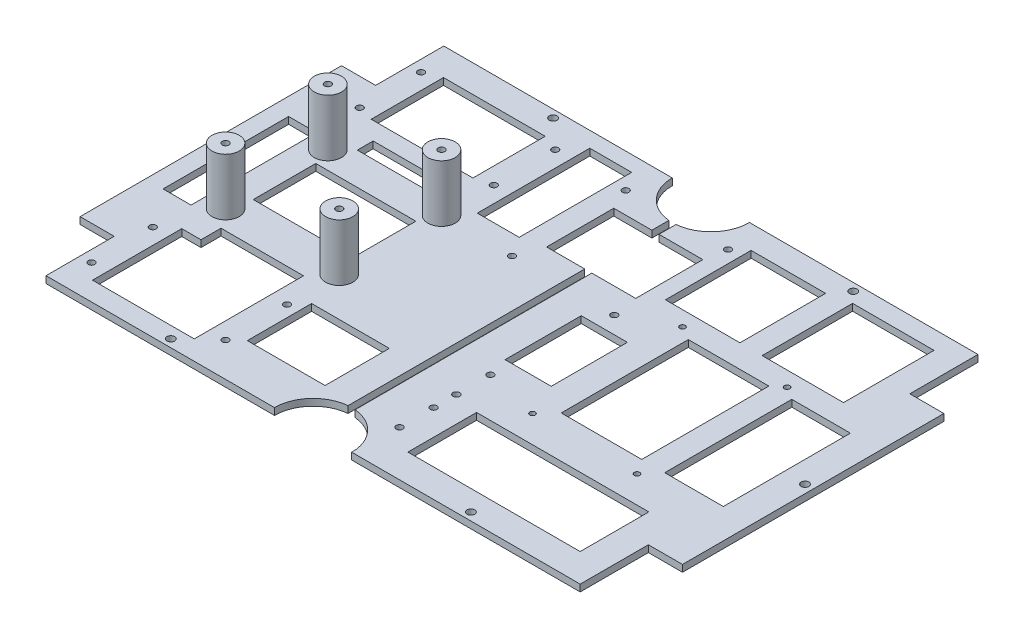
from build123d import *

# Parameters (mm, degrees)
SKETCH1_W           = 265
SKETCH1_H           = 175
BOSS_EXTRUDE3_DEPTH = 3
SKETCH2_R           = 1.2
SKETCH2_R_2         = 1.45
CUT_EXTRUDE1_DEPTH  = 10
SKETCH3_R           = 1.7
CUT_EXTRUDE2_DEPTH  = 10
SKETCH4_R           = 17
SKETCH4_W           = 15
SKETCH4_H           = 30
CUT_EXTRUDE3_DEPTH  = 10
SKETCH5_R           = 6
BOSS_EXTRUDE4_DEPTH = 25
SKETCH6_R           = 1.45
CUT_EXTRUDE4_DEPTH  = 16
SKETCH7_W           = 3.133632398
SKETCH7_H           = 141.144714622
CUT_EXTRUDE5_DEPTH  = 16
SKETCH8_W           = 44.004051782
SKETCH8_H           = 27.502532364
SKETCH8_W_2         = 12.303764479
SKETCH8_H_2         = 55.212044537
SKETCH8_W_3         = 44.752484312
SKETCH8_H_3         = 31.794399539
SKETCH8_W_4         = 18.417789402
SKETCH8_H_4         = 49.48036565
SKETCH8_W_5         = 35.622307927
SKETCH8_H_5         = 6.958328597
SKETCH8_W_6         = 34.203626282
SKETCH8_H_6         = 28.27990646
SKETCH8_W_7         = 39.195026094
SKETCH8_H_7         = 29.538035132
SKETCH8_W_8         = 32.745400695
SKETCH8_H_8         = 37.666328028
SKETCH8_W_9         = 35.809297836
SKETCH8_H_9         = 39.795761931
SKETCH8_W_10        = 35.421118703
SKETCH8_H_10        = 55.905577856
SKETCH8_W_11        = 20.303215676
SKETCH8_H_11        = 33.500994529
SKETCH8_W_12        = 75.78944242
SKETCH8_H_12        = 30.210998937
SKETCH8_W_13        = 25.777903598
CUT_EXTRUDE6_DEPTH  = 10


with BuildPart() as part:
    # Sketch1 → Boss-Extrude3 (new body)
    with BuildSketch(Plane(origin=(0, 0, 0), x_dir=(1, 0, 0), z_dir=(0, 1, 0))):
        Rectangle(SKETCH1_W, SKETCH1_H)
    extrude(amount=BOSS_EXTRUDE3_DEPTH)

    # Sketch2 → Cut-Extrude1 (cut)
    with BuildSketch(Plane(origin=(0, 3, 0), x_dir=(1, 0, 0), z_dir=(0, 1, 0))):
        with Locations((88, 33)):
            Circle(SKETCH2_R)
        with Locations((42, 33)):
            Circle(SKETCH2_R)
        with Locations((88, -33)):
            Circle(SKETCH2_R)
        with Locations((42, -33)):
            Circle(SKETCH2_R)
        with Locations((18, -67.5)):
            Circle(SKETCH2_R_2)
        with Locations((18, -52.5)):
            Circle(SKETCH2_R_2)
        with Locations((18, -42.5)):
            Circle(SKETCH2_R_2)
        with Locations((18, -27.5)):
            Circle(SKETCH2_R_2)
        with Locations((-53.5, -72.5)):
            Circle(SKETCH2_R_2)
        with Locations((-53.5, -45.5)):
            Circle(SKETCH2_R_2)
        with Locations((-112.5, -45.5)):
            Circle(SKETCH2_R_2)
        with Locations((-112.5, -72.5)):
            Circle(SKETCH2_R_2)
        with Locations((-112.5, 45.5)):
            Circle(SKETCH2_R_2)
        with Locations((-53.5, 45.5)):
            Circle(SKETCH2_R_2)
        with Locations((-53.5, 72.5)):
            Circle(SKETCH2_R_2)
        with Locations((-112.5, 72.5)):
            Circle(SKETCH2_R_2)
        with Locations((-22.5, 22.5)):
            Circle(SKETCH2_R_2)
        with Locations((22.5, 22.5)):
            Circle(SKETCH2_R_2)
        with Locations((-22.5, 72.5)):
            Circle(SKETCH2_R_2)
        with Locations((22.5, 72.5)):
            Circle(SKETCH2_R_2)
    extrude(amount=-CUT_EXTRUDE1_DEPTH, mode=Mode.SUBTRACT)

    # Sketch3 → Cut-Extrude2 (cut)
    with BuildSketch(Plane(origin=(0, 3, 0), x_dir=(1, 0, 0), z_dir=(0, 1, 0))):
        with Locations((-66, 84.1)):
            Circle(SKETCH3_R)
        with Locations((-128.9, 0)):
            Circle(SKETCH3_R)
        with Locations((-66, -84.1)):
            Circle(SKETCH3_R)
        with Locations((66, -84.1)):
            Circle(SKETCH3_R)
        with Locations((66, 84.1)):
            Circle(SKETCH3_R)
        with Locations((128.9, 0)):
            Circle(SKETCH3_R)
    extrude(amount=-CUT_EXTRUDE2_DEPTH, mode=Mode.SUBTRACT)

    # Sketch4 → Cut-Extrude3 (cut)
    with BuildSketch(Plane(origin=(0, 3, 0), x_dir=(1, 0, 0), z_dir=(0, 1, 0))):
        with Locations((0, 87.5)):
            Circle(SKETCH4_R)
        with Locations((0, -87.5)):
            Circle(SKETCH4_R)
        with Locations((-125, 72.5)):
            Rectangle(SKETCH4_W, SKETCH4_H)
        with Locations((-125, -72.5)):
            Rectangle(SKETCH4_W, SKETCH4_H)
        with Locations((125, -72.5)):
            Rectangle(SKETCH4_W, SKETCH4_H)
        with Locations((125, 72.5)):
            Rectangle(SKETCH4_W, SKETCH4_H)
    extrude(amount=-CUT_EXTRUDE3_DEPTH, mode=Mode.SUBTRACT)

    # Sketch5 → Boss-Extrude4 (add)
    with BuildSketch(Plane(origin=(0, 3, 0), x_dir=(1, 0, 0), z_dir=(0, 1, 0))):
        with Locations((-53.5, 22.5)):
            Circle(SKETCH5_R)
        with Locations((-53.5, -22.5)):
            Circle(SKETCH5_R)
        with Locations((-103.5, -22.5)):
            Circle(SKETCH5_R)
        with Locations((-103.5, 22.5)):
            Circle(SKETCH5_R)
    extrude(amount=BOSS_EXTRUDE4_DEPTH)

    # Sketch6 → Cut-Extrude4 (cut)
    with BuildSketch(Plane(origin=(0, 28, 0), x_dir=(1, 0, 0), z_dir=(0, 1, 0))):
        with Locations((-103.5, 22.5)):
            Circle(SKETCH6_R)
        with Locations((-53.5, 22.5)):
            Circle(SKETCH6_R)
        with Locations((-53.5, -22.5)):
            Circle(SKETCH6_R)
        with Locations((-103.5, -22.5)):
            Circle(SKETCH6_R)
    extrude(amount=-CUT_EXTRUDE4_DEPTH, mode=Mode.SUBTRACT)

    # Sketch7 → Cut-Extrude5 (cut)
    with BuildSketch(Plane(origin=(0, 3, 0), x_dir=(1, 0, 0), z_dir=(0, 1, 0))):
        Rectangle(SKETCH7_W, SKETCH7_H)
    extrude(amount=-CUT_EXTRUDE5_DEPTH, mode=Mode.SUBTRACT)


with BuildPart() as cut_extrude5_piece_1:
    # of the separate pieces the step leaves, piece 1, a body of its own (cut_extrude5_pieces)
    add(part.part.solids().sort_by_distance((-117.5, 0, -87.5))[0])


with BuildPart() as cut_extrude5_piece_2:
    # of the separate pieces the step leaves, piece 2, a body of its own (cut_extrude5_pieces)
    add(part.part.solids().sort_by_distance((1.566816199, 0, -70.572357311))[0])


with BuildPart() as cut_extrude6_tool:
    # Sketch8 → Cut-Extrude6 (new body)
    with BuildSketch(Plane(origin=(0, 3, 0), x_dir=(1, 0, 0), z_dir=(0, 1, 0))):
        with Locations((-78.918320173, 0.855666755)):
            Rectangle(SKETCH8_W, SKETCH8_H)
        with Locations((-118.65224193, -1.087828844)):
            Rectangle(SKETCH8_W_2, SKETCH8_H_2)
        with Locations((-83.191731608, 59.522375806)):
            Rectangle(SKETCH8_W_3, SKETCH8_H_3)
        with Locations((-37.255467463, 55.937928823)):
            Rectangle(SKETCH8_W_4, SKETCH8_H_4)
        with Locations((-79.05742687, 32.298336537)):
            Rectangle(SKETCH8_W_5, SKETCH8_H_5)
        Polygon((-105.567973764, -39.71130787), (-105.567973764, -78.974026671), (-60.815489452, -78.974026671), (-60.815489452, -30.899446131), (-97.101226796, -30.899446131), (-97.101226796, -39.71130787), align=None)
        with Locations((-31.38483974, -53.81421566)):
            Rectangle(SKETCH8_W_6, SKETCH8_H_6)
        with Locations((1.26798102, 48.327638245)):
            Rectangle(SKETCH8_W_7, SKETCH8_H_7)
        with Locations((44.324575156, 58.40829682)):
            Rectangle(SKETCH8_W_8, SKETCH8_H_8)
        with Locations((88.368096558, 59.473013771)):
            Rectangle(SKETCH8_W_9, SKETCH8_H_9)
        with Locations((65.827945176, 1.492751977)):
            Rectangle(SKETCH8_W_10, SKETCH8_H_10)
        with Locations((25.617903277, -1.759507226)):
            Rectangle(SKETCH8_W_11, SKETCH8_H_11)
        with Locations((67.190705071, -59.996509461)):
            Rectangle(SKETCH8_W_12, SKETCH8_H_12)
        with Locations((106.53191659, 1.492751977)):
            Rectangle(SKETCH8_W_13, SKETCH8_H_10)
    extrude(amount=-CUT_EXTRUDE6_DEPTH)


with BuildPart() as cut_extrude5_piece_1_1:
    add(cut_extrude5_piece_1.part)

    # Cut-Extrude6: cut by cut_extrude6_tool
    add(cut_extrude6_tool.part, mode=Mode.SUBTRACT)


with BuildPart() as cut_extrude5_piece_2_1:
    add(cut_extrude5_piece_2.part)

    # Cut-Extrude6: cut by cut_extrude6_tool
    add(cut_extrude6_tool.part, mode=Mode.SUBTRACT)


solid = Compound([cut_extrude5_piece_1_1.part, cut_extrude5_piece_2_1.part])
